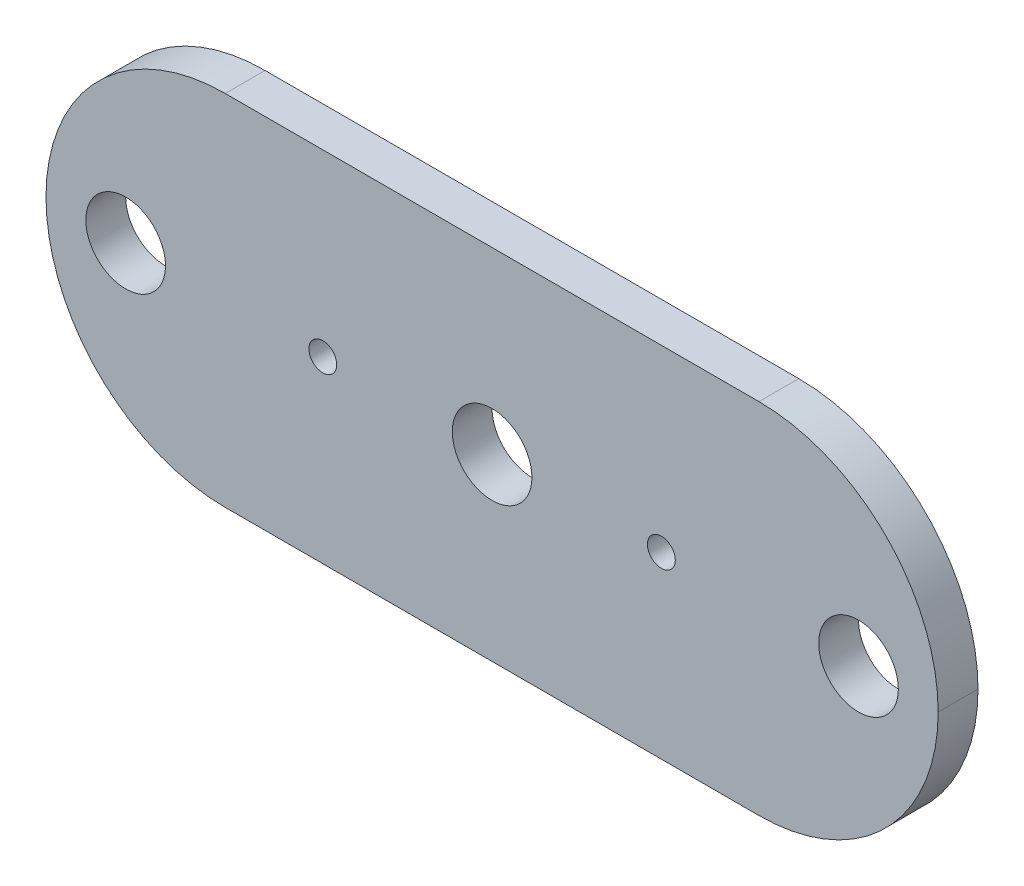
from build123d import *

# Parameters (mm, degrees)
ESQUISSE1_W        = 112
ESQUISSE1_H        = 45
ESQUISSE1_R        = 1.75
ESQUISSE1_R_2      = 5
BOSS_EXTRU_1_DEPTH = 5
CONG_1_R           = 22.5


with BuildPart() as part:
    # Esquisse1 → Boss.-Extru.1 (new body)
    with BuildSketch(Plane.XY):
        Rectangle(ESQUISSE1_W, ESQUISSE1_H)
        with Locations((21.25, 0)):
            Circle(ESQUISSE1_R, mode=Mode.SUBTRACT)
        with Locations(Location((-21.25, 0, 0), (0, 0, 180))):
            Circle(ESQUISSE1_R, mode=Mode.SUBTRACT)
        with Locations((46, 0)):
            Circle(ESQUISSE1_R_2, mode=Mode.SUBTRACT)
        with Locations(Location((-46, 0, 0), (0, 0, 180))):
            Circle(ESQUISSE1_R_2, mode=Mode.SUBTRACT)
        Circle(ESQUISSE1_R_2, mode=Mode.SUBTRACT)
    extrude(amount=BOSS_EXTRU_1_DEPTH)

    # Congé1
    cong_1_edges = [part.edges().sort_by_distance(p)[0] for p in [
        (-56, -22.5, 2.5),
        (-56, 22.5, 2.5),
        (56, -22.5, 2.5),
        (56, 22.5, 2.5),
    ]]
    fillet(cong_1_edges, radius=CONG_1_R - 0.0001)  # a hair under: the kernel refuses the full size


solid = part.part
